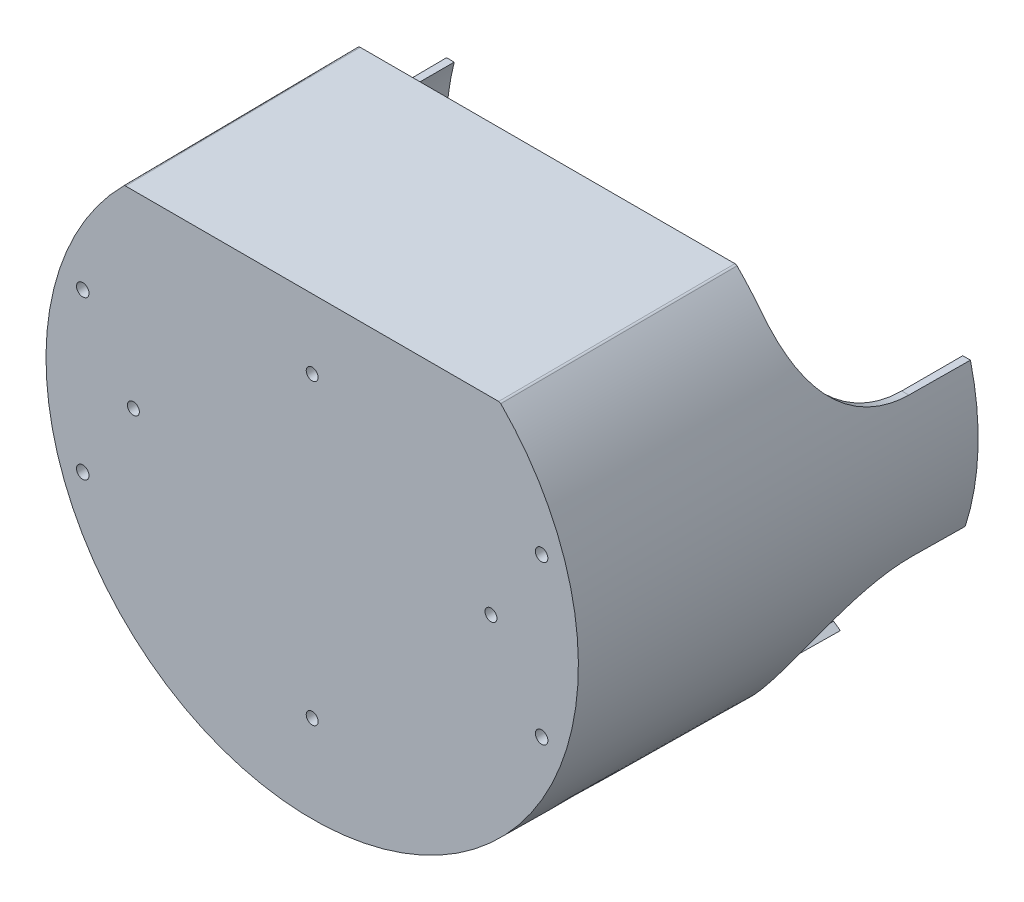
from build123d import *

# Parameters (mm, degrees)
EXTRUDE_1_DEPTH       = 133
CUT_EXTRUDE_2_REACH   = 225.393
SKETCH_2_W            = 126.964561984
SKETCH_2_H            = 54
SKETCH_13_R           = 7
CUT_EXTRUDE_7_DEPTH   = 10
EXTRUDE_START         = -3
EXTRUDE_11_DEPTH      = 3
CUT_EXTRUDE_START     = -10
CUT_EXTRUDE_22_DEPTH  = 62
CUT_EXTRUDE_23_REACH  = 225.393
SKETCH_27_R           = 10
DRAFT_START           = 64.497544038
DRAFT_1_2_OUTLINE_W   = 130
DRAFT_1_2_OUTLINE_H   = 82
DRAFT_1_2_DEPTH       = 2.502455962
CUT_EXTRUDE_1_DEPTH   = 175
CUT_EXTRUDE_2_2_DEPTH = 131
SKETCH_45_W           = 4.117502031
SKETCH_45_H           = 5
EXTRUDE_1_2_DEPTH     = 133
SKETCH_46_R           = 2.1
CUT_EXTRUDE_5_DEPTH   = 77
FILLET_1_R            = 1
FILLET_2_R            = 1
SKETCH_48_R           = 2
CUT_EXTRUDE_9_DEPTH   = 10
SKETCH_49_R           = 4
SKETCH_49_R_2         = 2.5
EXTRUDE_2_DEPTH       = 10


with BuildPart() as part:
    # 草图1 → Extrude 1 (new body)
    with BuildSketch(Plane.XY):
        with BuildLine():
            Line((63.482280992, 64.5), (-63.482280992, 64.5))
            ThreePointArc((-63.482280992, 64.5), (0, -90.5), (63.482280992, 64.5))
        make_face()
        with BuildLine():
            Line((-62.449979984, 62), (62.449979984, 62))
            ThreePointArc((62.449979984, 62), (0, -88), (-62.449979984, 62))
        make_face(mode=Mode.SUBTRACT)
    extrude(amount=EXTRUDE_1_DEPTH)

    # 草图2 → Cut-Extrude 2 (cut, up to next)
    with BuildSketch(Plane(origin=(0, 64.5, 0), x_dir=(1, 0, 0), z_dir=(0, 1, 0)), mode=Mode.PRIVATE) as cut_extrude_2_sk1:
        with Locations((0, -27)):
            Rectangle(SKETCH_2_W, SKETCH_2_H)
    cut_extrude_2_tool1 = extrude(cut_extrude_2_sk1.sketch, amount=-CUT_EXTRUDE_2_REACH, mode=Mode.PRIVATE) & part.part
    add(cut_extrude_2_tool1.solids().sort_by_distance((0, 64.5, 27))[0], mode=Mode.SUBTRACT)

    # 草图13 → 拉伸7 (cut)
    with BuildSketch(Plane(origin=(0, -90.5, 133), x_dir=(1, 0, 0), z_dir=(0, -1, 0))):
        with Locations((0, -123)):
            Circle(SKETCH_13_R)
        with BuildLine():
            Line((-10, -75), (-10, -90))
            ThreePointArc((-10, -90), (0, -100), (10, -90))
            Line((10, -90), (10, -75))
            ThreePointArc((10, -75), (0, -65), (-10, -75))
        make_face()
    extrude(amount=-CUT_EXTRUDE_7_DEPTH, mode=Mode.SUBTRACT)

    # 草图15 → 拉伸11 (add)
    with BuildSketch(Plane.XY.offset(133).offset(EXTRUDE_START)):
        with BuildLine():
            Line((63.482280992, 64.5), (-63.482280992, 64.5))
            ThreePointArc((-63.482280992, 64.5), (0, -90.5), (63.482280992, 64.5))
        make_face()
    extrude(amount=EXTRUDE_11_DEPTH)

    # 草图22 → 拉伸22 (cut)
    with BuildSketch(Plane(origin=(63.482280992, 0, 0), x_dir=(0, 0, -1), z_dir=(1, 0, 0)).offset(CUT_EXTRUDE_START)):
        with BuildLine():
            Line((-20.5, 21.5), (49.225954882, 21.5))
            Line((49.225954882, 21.5), (49.225954882, 64.5))
            Line((49.225954882, 64.5), (-54, 64.5))
            Line((-54, 64.5), (-54, 55))
            ThreePointArc((-54, 55), (-44.18807717, 31.31192283), (-20.5, 21.5))
        make_face()
    cut_extrude_22 = extrude(amount=CUT_EXTRUDE_22_DEPTH, mode=Mode.SUBTRACT)

    # 镜向6: 拉伸22 across plane
    add(cut_extrude_22.mirror(Plane.ZY), mode=Mode.SUBTRACT)

    # 草图27 → 拉伸23 (cut, up to next)
    with BuildSketch(Plane(origin=(0, -90.5, 133), x_dir=(1, 0, 0), z_dir=(0, -1, 0)), mode=Mode.PRIVATE) as cut_extrude_23_sk1:
        with Locations((50, -33)):
            Circle(SKETCH_27_R)
    cut_extrude_23_tool1 = extrude(cut_extrude_23_sk1.sketch, amount=-CUT_EXTRUDE_23_REACH, mode=Mode.PRIVATE) & part.part
    cut_extrude_23 = cut_extrude_23_tool1.solids().sort_by_distance((50, -90.5, 100))[0]
    add(cut_extrude_23, mode=Mode.SUBTRACT)

    # 镜向7: 拉伸23 across plane
    add(cut_extrude_23.mirror(Plane.ZY), mode=Mode.SUBTRACT)

    # 拔模1: read off the stored shape, not the designer's step
    # 拔模1 outline → 拔模1 (revolve, cut)
    with BuildSketch(Plane.XZ):
        Polygon((90.5, 133), (89.339326584, 133), (90.5, 0), align=None)
    revolve(axis=Axis((0, 0, 0), (0, 0, 1)), mode=Mode.SUBTRACT)

    # Draft 1 2 outline → Draft 1 2 (cut)
    with BuildSketch(Plane(origin=(0, 0, 0), x_dir=(1, 0, 0), z_dir=(0, 0.9999619230641713, 0.008726535498373954)).offset(DRAFT_START)):
        with Locations((0, -93)):
            Rectangle(DRAFT_1_2_OUTLINE_W, DRAFT_1_2_OUTLINE_H)
    extrude(amount=DRAFT_1_2_DEPTH, mode=Mode.SUBTRACT)

    # 草图40 → 切除-拉伸1 (cut)
    with BuildSketch(Plane(origin=(-55.702339012, -39.003197672, 0), x_dir=(0, 0, 1), z_dir=(-0.8191520442889892, -0.5735764363510497, 0))):
        with BuildLine():
            Line((17.5, -39.276608177), (-65.178902378, -39.276608177))
            ThreePointArc((-65.178902378, -39.276608177), (-98.178902378, -6.276608177), (-65.178902378, 26.723391823))
            Line((-65.178902378, 26.723391823), (17.5, 26.723391823))
            ThreePointArc((17.5, 26.723391823), (50.5, -6.276608177), (17.5, -39.276608177))
        make_face()
    extrude(amount=CUT_EXTRUDE_1_DEPTH, mode=Mode.SUBTRACT)

    # 草图41 → Cut-Extrude 2 2 (cut)
    with BuildSketch(Plane(origin=(55.702339012, -39.003197672, 0), x_dir=(-0.5735764363510498, -0.8191520442889892, 0), z_dir=(0.8191520442889892, -0.5735764363510498, 0))):
        with BuildLine():
            Line((-26.723391823, -17.5), (-26.723391823, 45.018999614))
            ThreePointArc((-26.723391823, 45.018999614), (6.276608177, 78.018999614), (39.276608177, 45.018999614))
            Line((39.276608177, 45.018999614), (39.276608177, -17.5))
            ThreePointArc((39.276608177, -17.5), (6.276608177, -50.5), (-26.723391823, -17.5))
        make_face()
    extrude(amount=CUT_EXTRUDE_2_2_DEPTH, mode=Mode.SUBTRACT)

    # 草图45 → Extrude 1 2 (add)
    with BuildSketch(Plane.XY.offset(133)):
        with Locations((-86.058751016, -1.5)):
            Rectangle(SKETCH_45_W, SKETCH_45_H)
    extrude_1_2 = extrude(amount=-EXTRUDE_1_2_DEPTH)

    # 镜向8: Extrude 1 2 across plane
    add(extrude_1_2.mirror(Plane(origin=(0, 0, 0), x_dir=(0, 0, 1), z_dir=(1, 0, 0))))

    # 草图46 → 切除-拉伸5 (cut)
    with BuildSketch(Plane(origin=(0, 0, 130), x_dir=(-1, 0, 0), z_dir=(0, 0, -1))):
        with Locations((-77, -27)):
            Circle(SKETCH_46_R)
        with Locations((-77, 26)):
            Circle(SKETCH_46_R)
        with Locations((77, 26)):
            Circle(SKETCH_46_R)
        with Locations((77, -27)):
            Circle(SKETCH_46_R)
    extrude(amount=-CUT_EXTRUDE_5_DEPTH, mode=Mode.SUBTRACT)

    # 圆角1
    fillet_1_edges = [part.edges().sort_by_distance(p)[0] for p in [
        (-84, 1, 65),
        (-84, -4, 65),
        (84, -4, 65),
        (84, 1, 65),
    ]]
    fillet(fillet_1_edges, radius=FILLET_1_R)

    # 圆角2
    fillet_2_edges = [part.edges().sort_by_distance(p)[0] for p in [
        (-63.147208715, 63.684037857, 93.500000571),
        (63.147208715, 63.684037857, 93.500000571),
        (62.449979984, 62, 92),
        (-62.449979984, 62, 92),
    ]]
    fillet(fillet_2_edges, radius=FILLET_2_R)

    # 草图48 → 切除-拉伸9 (cut)
    with BuildSketch(Plane.XY.offset(133)):
        with Locations((-60, 0)):
            Circle(SKETCH_48_R)
        with Locations((60, 0)):
            Circle(SKETCH_48_R)
        with Locations((0, 40)):
            Circle(SKETCH_48_R)
        with Locations((0, -60)):
            Circle(SKETCH_48_R)
    extrude(amount=-CUT_EXTRUDE_9_DEPTH, mode=Mode.SUBTRACT)

    # 草图49 → 凸台-拉伸2 (add)
    # profile 1 of 2: a face of its own
    with BuildSketch(Plane(origin=(0, 0, 130), x_dir=(-1, 0, 0), z_dir=(0, 0, -1))):
        with Locations(Location((-37, -13, 0), (0, 0, 180))):
            Circle(SKETCH_49_R)
        with Locations((-37, -13)):
            Circle(SKETCH_49_R_2, mode=Mode.SUBTRACT)
    # profile 2 of 2: a face of its own
    with BuildSketch(Plane(origin=(0, 0, 130), x_dir=(-1, 0, 0), z_dir=(0, 0, -1))):
        with Locations(Location((-37, -28, 0), (0, 0, 180))):
            Circle(SKETCH_49_R)
        with Locations((-37, -28)):
            Circle(SKETCH_49_R_2, mode=Mode.SUBTRACT)
    extrude(amount=EXTRUDE_2_DEPTH)


solid = part.part
